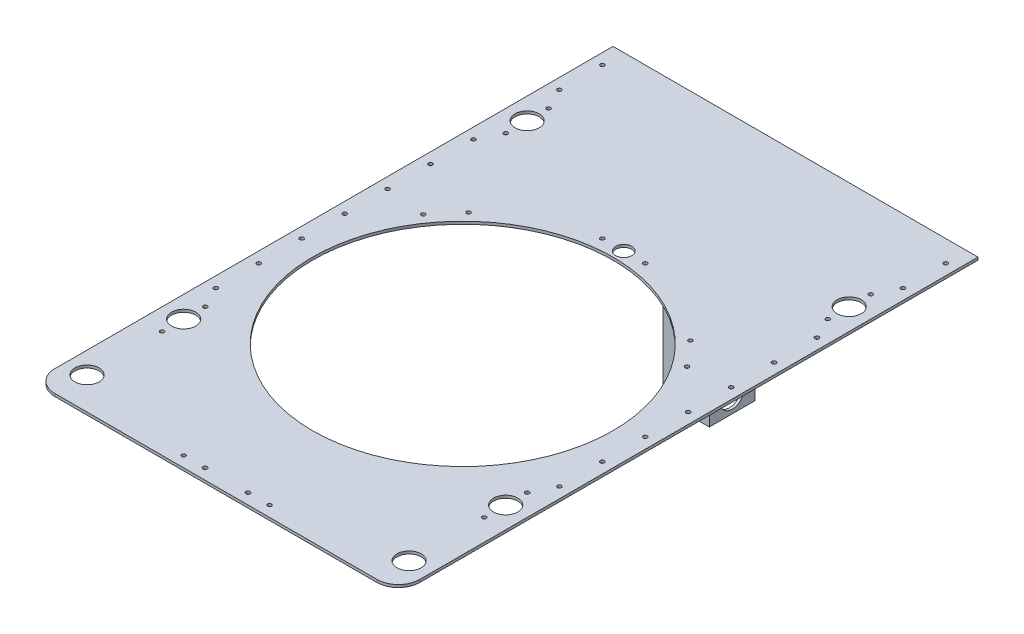
from build123d import *

# Parameters (mm, degrees)
SKETCH1_W           = 431.8
SKETCH1_H           = 685.8
BOSS_EXTRUDE1_DEPTH = 3.175
SKETCH2_R           = 14.3129
SKETCH2_R_2         = 2.38125
CUT_EXTRUDE1_DEPTH  = 406.22006444
SKETCH3_W           = 54.61
SKETCH3_H           = 53.975
BOSS_EXTRUDE2_DEPTH = 203.2
FILLET1_R           = 20.32
SKETCH4_W           = 48.26
SKETCH4_H           = 47.625
CUT_EXTRUDE2_DEPTH  = 203.2
SKETCH5_R           = 14.2875
CUT_EXTRUDE3_DEPTH  = 203.2
SKETCH6_R           = 177.8
CUT_EXTRUDE4_DEPTH  = 455.734934467
SKETCH8_R           = 9.525
SKETCH8_R_2         = 2.38125
CUT_EXTRUDE6_DEPTH  = 455.734934467
FILLET2_R           = 25.4
SKETCH10_R          = 14.3129
SKETCH10_R_2        = 2.38125
CUT_EXTRUDE8_DEPTH  = 455.734934467
SKETCH11_R          = 2.38125
CUT_EXTRUDE9_DEPTH  = 455.734934467
SKETCH13_R          = 2.38125
SKETCH13_R_2        = 2.466421692
SKETCH13_R_3        = 2.307769972
CUT_EXTRUDE10_DEPTH = 455.734934467


with BuildPart() as part:
    # Sketch1 → Boss-Extrude1 (new body)
    with BuildSketch(Plane(origin=(0, 0, 0), x_dir=(1, 0, 0), z_dir=(0, 1, 0))):
        Rectangle(SKETCH1_W, SKETCH1_H)
    extrude(amount=BOSS_EXTRUDE1_DEPTH)

    # Sketch2 → Cut-Extrude1 (cut, through all)
    with BuildSketch(Plane(origin=(0, 3.175, 0), x_dir=(1, 0, 0), z_dir=(0, 1, 0))):
        with Locations((-190.5, -304.8)):
            Circle(SKETCH2_R)
        with Locations((-190.5, -190.5)):
            Circle(SKETCH2_R)
        with Locations((190.5, -304.8)):
            Circle(SKETCH2_R)
        with Locations((190.5, -190.5)):
            Circle(SKETCH2_R)
        with Locations((190.5, -215.9)):
            Circle(SKETCH2_R_2)
        with Locations((190.5, -165.1)):
            Circle(SKETCH2_R_2)
        with Locations((-190.5, -215.9)):
            Circle(SKETCH2_R_2)
        with Locations((-190.5, -165.1)):
            Circle(SKETCH2_R_2)
    extrude(amount=-CUT_EXTRUDE1_DEPTH, mode=Mode.SUBTRACT)

    # Sketch3 → Boss-Extrude2 (add)
    with BuildSketch(Plane(origin=(0, 0, 0), x_dir=(-1, 0, 0), z_dir=(0, -1, 0))):
        with Locations((2.565647285, 243.220856884)):
            Rectangle(SKETCH3_W, SKETCH3_H)
    extrude(amount=BOSS_EXTRUDE2_DEPTH)

    # Fillet1
    fillet1_edges = [part.edges().sort_by_distance(p)[0] for p in [
        (24.739352715, 0, -243.220856884),
        (-2.565647285, 0, -270.208356884),
        (-2.565647285, 0, -216.233356884),
        (-29.870647285, 0, -243.220856884),
    ]]
    fillet(fillet1_edges, radius=FILLET1_R)

    # Sketch4 → Cut-Extrude2 (cut)
    with BuildSketch(Plane(origin=(0, -203.2, 0), x_dir=(-1, 0, 0), z_dir=(0, -1, 0))):
        with Locations((2.565647285, 243.220856884)):
            Rectangle(SKETCH4_W, SKETCH4_H)
    extrude(amount=-CUT_EXTRUDE2_DEPTH, mode=Mode.SUBTRACT)

    # Sketch5 → Cut-Extrude3 (cut)
    with BuildSketch(Plane.ZY.offset(29.870647285)):
        with Locations((-243.220856884, -184.15)):
            Circle(SKETCH5_R)
    extrude(amount=-CUT_EXTRUDE3_DEPTH, mode=Mode.SUBTRACT)

    # Sketch6 → Cut-Extrude4 (cut, through all)
    with BuildSketch(Plane(origin=(0, 3.175, 0), x_dir=(1, 0, 0), z_dir=(0, 1, 0))):
        with Locations((0, -50.8)):
            Circle(SKETCH6_R)
    extrude(amount=-CUT_EXTRUDE4_DEPTH, mode=Mode.SUBTRACT)

    # Sketch8 → Cut-Extrude6 (cut, through all)
    with BuildSketch(Plane(origin=(0, 3.175, 0), x_dir=(1, 0, 0), z_dir=(0, 1, 0))):
        with Locations((0, 139.7)):
            Circle(SKETCH8_R)
        with Locations((25.4, 139.7)):
            Circle(SKETCH8_R_2)
        with Locations((-25.4, 139.7)):
            Circle(SKETCH8_R_2)
    extrude(amount=-CUT_EXTRUDE6_DEPTH, mode=Mode.SUBTRACT)

    # Fillet2
    fillet2_edges = [part.edges().sort_by_distance(p)[0] for p in [
        (215.9, 1.5875, 342.9),
        (-215.9, 1.5875, 342.9),
    ]]
    fillet(fillet2_edges, radius=FILLET2_R)

    # Sketch10 → Cut-Extrude8 (cut, through all)
    with BuildSketch(Plane(origin=(0, 3.175, 0), x_dir=(1, 0, 0), z_dir=(0, 1, 0))):
        with Locations((-190.5, 215.9)):
            Circle(SKETCH10_R)
        with Locations((190.5, 215.9)):
            Circle(SKETCH10_R)
        with Locations((190.5, 190.5)):
            Circle(SKETCH10_R_2)
        with Locations((190.5, 241.3)):
            Circle(SKETCH10_R_2)
        with Locations((-190.5, 190.5)):
            Circle(SKETCH10_R_2)
        with Locations((-190.5, 241.3)):
            Circle(SKETCH10_R_2)
    extrude(amount=-CUT_EXTRUDE8_DEPTH, mode=Mode.SUBTRACT)

    # Sketch11 → Cut-Extrude9 (cut, through all)
    with BuildSketch(Plane(origin=(0, 3.175, 0), x_dir=(1, 0, 0), z_dir=(0, 1, 0))):
        with Locations((156.048464437, 58.466311125)):
            Circle(SKETCH11_R)
        with Locations((131.183773775, 87.334237241)):
            Circle(SKETCH11_R)
        with Locations((-131.183773775, 87.334237241)):
            Circle(SKETCH11_R)
        with Locations((-156.048464437, 58.466311125)):
            Circle(SKETCH11_R)
    extrude(amount=-CUT_EXTRUDE9_DEPTH, mode=Mode.SUBTRACT)

    # Sketch13 → Cut-Extrude10 (cut, through all)
    with BuildSketch(Plane(origin=(0, 3.175, 0), x_dir=(1, 0, 0), z_dir=(0, 1, 0))):
        with Locations((-203.2, 317.5)):
            Circle(SKETCH13_R)
        with Locations((-203.2, 266.7)):
            Circle(SKETCH13_R)
        with Locations((-203.2, 165.1)):
            Circle(SKETCH13_R)
        with Locations((-203.2, 114.3)):
            Circle(SKETCH13_R)
        with Locations((-203.2, 63.5)):
            Circle(SKETCH13_R)
        with Locations((-203.2, 12.7)):
            Circle(SKETCH13_R)
        with Locations((-203.2, -38.1)):
            Circle(SKETCH13_R)
        with Locations((-203.2, -88.9)):
            Circle(SKETCH13_R)
        with Locations((-203.2, -139.7)):
            Circle(SKETCH13_R)
        with Locations((203.2, -139.7)):
            Circle(SKETCH13_R)
        with Locations((203.2, 12.7)):
            Circle(SKETCH13_R)
        with Locations((203.2, 63.5)):
            Circle(SKETCH13_R)
        with Locations((203.2, 114.3)):
            Circle(SKETCH13_R)
        with Locations((203.2, 165.1)):
            Circle(SKETCH13_R)
        with Locations((203.2, 266.7)):
            Circle(SKETCH13_R)
        with Locations((203.2, 317.5)):
            Circle(SKETCH13_R)
        with Locations((-25.4, -330.2)):
            Circle(SKETCH13_R_2)
        with Locations((-50.8, -330.2)):
            Circle(SKETCH13_R_3)
        with Locations((50.8, -330.2)):
            Circle(SKETCH13_R_3)
        with Locations((25.4, -330.2)):
            Circle(SKETCH13_R_2)
        with Locations((203.2, -88.9)):
            Circle(SKETCH13_R)
        with Locations((203.2, -38.1)):
            Circle(SKETCH13_R)
    extrude(amount=-CUT_EXTRUDE10_DEPTH, mode=Mode.SUBTRACT)


solid = part.part
